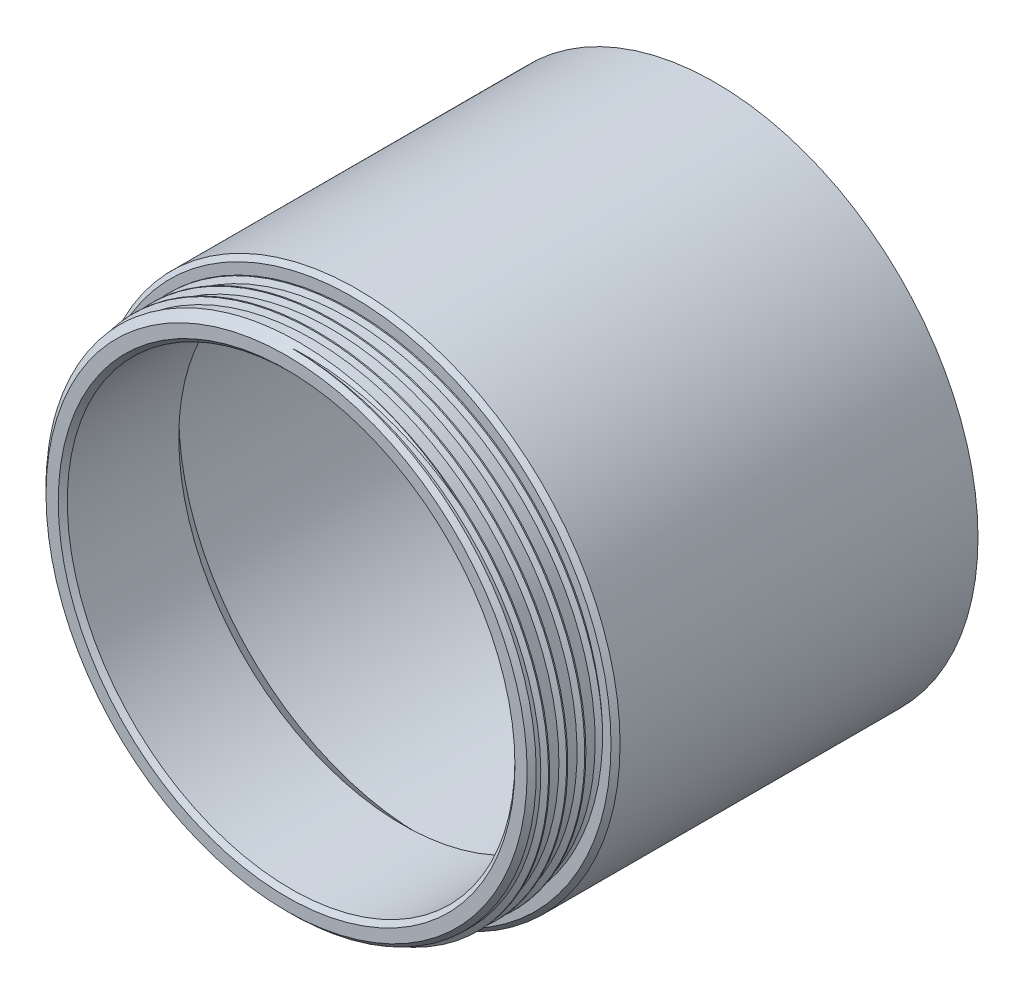
from build123d import *

# Parameters (mm, degrees)
SKETCH1_R           = 29
SKETCH1_R_2         = 26.9
EXTRUDE1_DEPTH      = 40
EXTRUDE2_DEPTH      = 7.3
EXTRUDE2_DEPTH_BACK = 8
SKETCH2_R           = 27.05
SKETCH2_R_2         = 24.7
THREAD1_PITCH       = 2
THREAD1_FROM        = 2
CHAMFER1_SIZE       = 0.5
CHAMFER2_SIZE       = 2.5
CHAMFER4_SIZE       = 0.25


with BuildPart() as part:
    # Sketch1 → Extrude1 (new body)
    with BuildSketch(Plane.XY):
        Circle(SKETCH1_R)
        Circle(SKETCH1_R_2, mode=Mode.SUBTRACT)
    extrude(amount=EXTRUDE1_DEPTH)

    # Sketch2 → Extrude2 (add, two sides: drawn at the far end of the back side and taken through both)
    with BuildSketch(Plane.XY.offset(40).offset(-EXTRUDE2_DEPTH_BACK)):
        Circle(SKETCH2_R)
        Circle(SKETCH2_R_2, mode=Mode.SUBTRACT)
    extrude(amount=EXTRUDE2_DEPTH + EXTRUDE2_DEPTH_BACK)

    # Thread1: arcs per turn and ends read off the stored shape
    # Thread1: the profile of Sketch4 profile screwed along a right-hand helix through 4.65 turns, 10 arcs to a turn; built about Z, then put on its axis
    thread1_z = Axis((0, 0, 0), (0, 0, 1))
    thread1_corners = [(27.0497, 0, -0.000173205), (27.591265875, 0, 0.312499999), (27.591265875, 0, 0.437499999), (27.0497, 0, 0.750173202)]
    with BuildLine(mode=Mode.PRIVATE) as thread1_profile:
        Line(thread1_corners[0], thread1_corners[1])
        Line(thread1_corners[1], thread1_corners[2])
        Line(thread1_corners[2], thread1_corners[3])
        Line(thread1_corners[3], thread1_corners[0])
    thread1_cap = Face(thread1_profile.wire())
    thread1_turn_angles = [0, 18, 36, 54, 72, 90, 108, 126, 144, 162, 180, 198, 216, 234, 252, 270, 288, 306, 324, 342, 360]
    thread1_turn_weights = [1, 0.9510565162951535, 1, 0.9510565162951535, 1, 0.9510565162951535, 1, 0.9510565162951535, 1, 0.9510565162951535, 1, 0.9510565162951535, 1, 0.9510565162951535, 1, 0.9510565162951535, 1, 0.9510565162951535, 1, 0.9510565162951535, 1]
    thread1_turn_rails = [Edge.make_bspline([Vector(p[0], p[1], 0).rotate(thread1_z, thread1_turn_angles[k]) / thread1_turn_weights[k] + Vector(0, 0, p[2] + THREAD1_PITCH * thread1_turn_angles[k] / 360) for k in range(21)], [0, 0, 0, 1, 1, 2, 2, 3, 3, 4, 4, 5, 5, 6, 6, 7, 7, 8, 8, 9, 9, 10, 10, 10], 2, thread1_turn_weights) for p in thread1_corners]
    thread1_turn_sides = [Face.make_surface_from_curves(thread1_turn_rails[p[0]], thread1_turn_rails[p[1]]) for p in [(0, 1), (1, 2), (2, 3), (3, 0)]]
    thread1_last_angles = [1440, 1458, 1476, 1494, 1512, 1530, 1548, 1566, 1584, 1602, 1620, 1638, 1656, 1665, 1674]
    thread1_last_weights = [1, 0.9510565162951535, 1, 0.9510565162951535, 1, 0.9510565162951535, 1, 0.9510565162951535, 1, 0.9510565162951535, 1, 0.9510565162951535, 1, 0.9876883405951371, 1]
    thread1_last_rails = [Edge.make_bspline([Vector(p[0], p[1], 0).rotate(thread1_z, thread1_last_angles[k]) / thread1_last_weights[k] + Vector(0, 0, p[2] + THREAD1_PITCH * thread1_last_angles[k] / 360) for k in range(15)], [0, 0, 0, 1, 1, 2, 2, 3, 3, 4, 4, 5, 5, 6, 6, 7, 7, 7], 2, thread1_last_weights) for p in thread1_corners]
    thread1_last_sides = [Face.make_surface_from_curves(thread1_last_rails[p[0]], thread1_last_rails[p[1]]) for p in [(0, 1), (1, 2), (2, 3), (3, 0)]]
    thread1 = Plane(origin=(0, 0, 49.3), x_dir=(-1, 0, 0), z_dir=(0, 0, -1)) * split(Solid(Shell([*[p.moved(Location((0, 0, THREAD1_PITCH * i))) for i in range(4) for p in thread1_turn_sides], *thread1_last_sides, thread1_cap, thread1_cap.rotate(thread1_z, 1674).moved(Location((0, 0, THREAD1_PITCH * 1674 / 360)))])), bisect_by=Plane.XY.offset(THREAD1_FROM), keep=Keep.TOP, mode=Mode.PRIVATE)
    add(thread1)

    # Chamfer1
    chamfer1_edges = [part.edges().sort_by_distance(p)[0] for p in [
        (-24.7, 0, 47.3),
        (-29, 0, 40),
    ]]
    chamfer(chamfer1_edges, length=CHAMFER1_SIZE)

    # Chamfer2
    # the kernel refuses this chamfer: 2.5 mm, written as the material it takes off along each edge
    with BuildSketch(Plane(origin=(0, 0, 32), x_dir=(1, 0, 0), z_dir=(0, -1, 0))) as chamfer2_piece_1_section:
        Polygon((24.7 + CHAMFER2_SIZE, 0), (24.7, CHAMFER2_SIZE), (24.7, 0), align=None)
    chamfer2_piece_1 = revolve(axis=Axis((0, 0, 32), (0, 0, 1)), mode=Mode.PRIVATE)
    chamfer2_piece_1 = chamfer2_piece_1 & Plane(origin=(0, 0, 32), x_dir=(1, 0, 0), z_dir=(0, 0, -1)) * Cylinder(26.9, 109, mode=Mode.PRIVATE)
    add(chamfer2_piece_1, mode=Mode.SUBTRACT)

    # Sketch7 → Cut-Revolve1 (revolve, cut)
    with BuildSketch(Plane(origin=(0, 0, 0), x_dir=(1, 0, 0), z_dir=(0, 1, 0))):
        Polygon((-28.009015865, -45.840984135), (-26.55, -47.3), (-27.05, -47.3), (-28.680601357, -47.3), (-28.680601357, -45.840984135), align=None)
    revolve(axis=Axis((0, 0, 0), (0, 0, 1)), mode=Mode.SUBTRACT)

    # Chamfer4
    chamfer4_edges = [part.edges().sort_by_distance(p)[0] for p in [
        (-26.9, 0, 0),
    ]]
    chamfer(chamfer4_edges, length=CHAMFER4_SIZE)


solid = part.part
